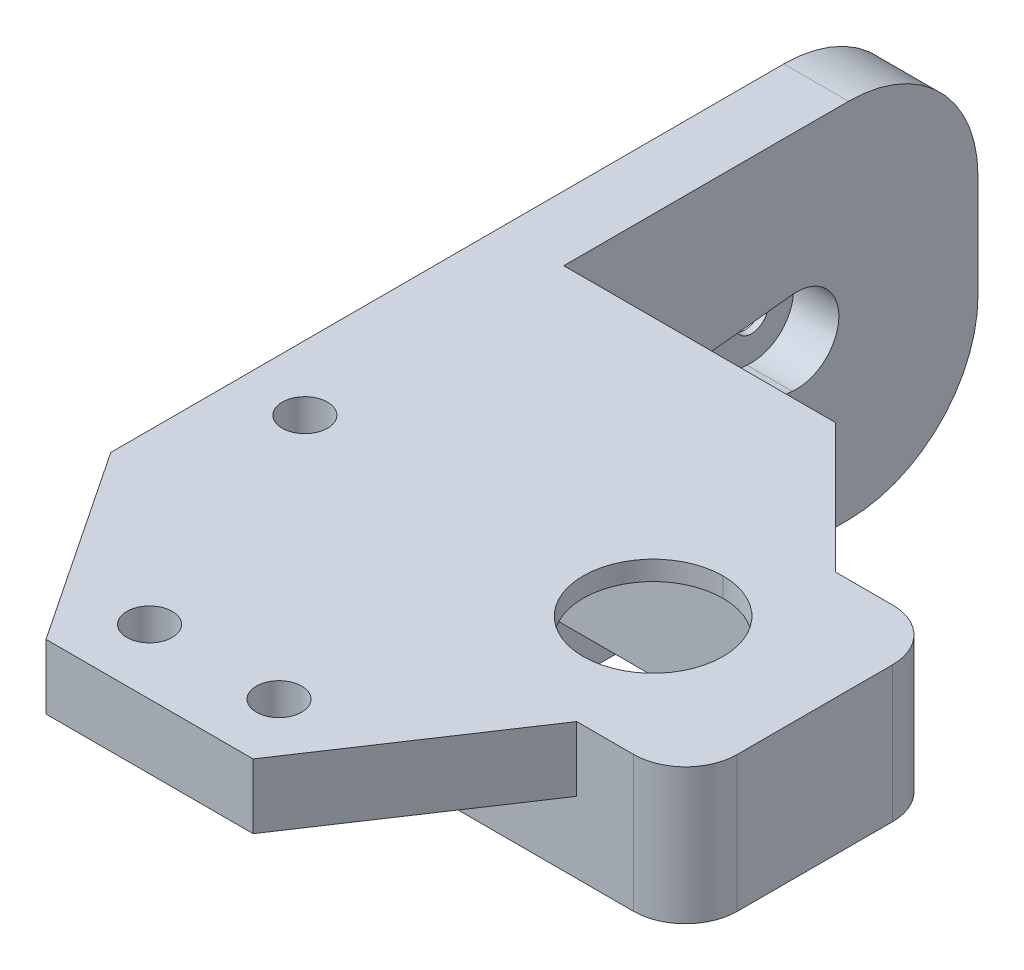
from build123d import *

# Parameters (mm, degrees)
SKETCH1_R                = 1.75
SKETCH1_W                = 7.2
SKETCH1_H                = 5.4
BOSS_EXTRUDE1_DEPTH      = 5
FILLET5_RADIUS           = 10
FILLET5_LENGTH           = 5
FILLET2_R                = 5.4
FILLET6_R                = 5.4
SKETCH3_W                = 6
SKETCH3_H                = 13
BOSS_EXTRUDE4_DEPTH      = 5.5
SKETCH5_W                = 23
SKETCH5_H                = 13
CUT_EXTRUDE1_DEPTH       = 3.5
CUT_EXTRUDE2_DEPTH       = 76.201396264
FILLET9_R                = 4
BOSS_EXTRUDE7_DEPTH      = 32
BOSS_EXTRUDE7_DEPTH_BACK = 12
SKETCH7_W                = 10
SKETCH7_H                = 28
FILLET10_R               = 10
SKETCH9_R                = 1
CUT_EXTRUDE4_DEPTH       = 7
SKETCH15_W               = 5
SKETCH15_H               = 32
CUT_EXTRUDE7_DEPTH       = 30
CUT_EXTRUDE8_DEPTH       = 5
CUT_EXTRUDE9_DEPTH       = 3.5
SKETCH22_R               = 1.3
CUT_EXTRUDE10_DEPTH      = 1.5
SKETCH22_3_R             = 2.35
SKETCH22_3_R_2           = 1.3
CUT_EXTRUDE11_DEPTH      = 1
SKETCH23_R               = 0.75
CUT_EXTRUDE12_DEPTH      = 1.75


with BuildPart() as part:
    # Sketch1 → Boss-Extrude1 (new body)
    # profile 1 of 4: a face of its own
    with BuildSketch(Plane(origin=(0, 0, 0), x_dir=(1, 0, 0), z_dir=(0, 1, 0))):
        with BuildLine():
            Line((3.25, 25), (0, 25))
            Line((0, 25), (0, 15))
            Line((0, 15), (10, 0))
            Line((10, 0), (26, 0))
            Line((26, 0), (36, 15))
            Line((36, 15), (60, 15))
            Line((60, 15), (60, 25))
            Line((60, 25), (44.5, 25))
            Line((44.5, 25), (44.5, 19.6))
            Line((44.5, 19.6), (37.3, 19.6))
            Line((37.3, 19.6), (26.5, 19.6))
            Line((26.5, 19.6), (26.5, 25))
            Line((26.5, 25), (6.75, 25))
            ThreePointArc((6.75, 25), (5, 23.25), (3.25, 25))
        make_face()
        with Locations(Location((13, 5, 0), (0, 0, 270))):
            Circle(SKETCH1_R, mode=Mode.SUBTRACT)
        with Locations(Location((23, 5, 0), (0, 0, 270))):
            Circle(SKETCH1_R, mode=Mode.SUBTRACT)
    # profile 2 of 4: a face of its own
    with BuildSketch(Plane(origin=(0, 0, 0), x_dir=(1, 0, 0), z_dir=(0, 1, 0))):
        with BuildLine():
            Line((10, 45), (0, 33.819660113))
            Line((0, 33.819660113), (0, 25))
            Line((0, 25), (3.25, 25))
            ThreePointArc((3.25, 25), (5, 26.75), (6.75, 25))
            Line((6.75, 25), (26.5, 25))
            Line((26.5, 25), (26.5, 30.4))
            Line((26.5, 30.4), (37.3, 30.4))
            Line((37.3, 30.4), (44.5, 30.4))
            Line((44.5, 30.4), (44.5, 25))
            Line((44.5, 25), (60, 25))
            Line((60, 25), (60, 35))
            Line((60, 35), (36, 35))
            Line((36, 35), (26, 45))
            Line((26, 45), (10, 45))
        make_face()
    # profile 3 of 4: a face of its own
    with BuildSketch(Plane(origin=(0, 0, 0), x_dir=(1, 0, 0), z_dir=(0, 1, 0))):
        with Locations((40.9, 27.7)):
            Rectangle(SKETCH1_W, SKETCH1_H)
    # profile 4 of 4: a face of its own
    with BuildSketch(Plane(origin=(0, 0, 0), x_dir=(1, 0, 0), z_dir=(0, 1, 0))):
        with Locations((40.9, 22.3)):
            Rectangle(SKETCH1_W, SKETCH1_H)
    extrude(amount=BOSS_EXTRUDE1_DEPTH)

    # Fillet5: full round fillet: the end face becomes a half cylinder, R = half its width
    fillet5_face = Plane((60, 2.5, -25), x_dir=(0, -1, 0), z_dir=(1, 0, 0))  # on the end face: x along it, z out of the body
    fillet5_slab = fillet5_face.offset(-FILLET5_RADIUS / 2) * Box(FILLET5_LENGTH, 2 * FILLET5_RADIUS, FILLET5_RADIUS, mode=Mode.PRIVATE)  # the body's end, R deep
    fillet5_round = Plane((50, 2.5, -25), x_dir=(1, 0, 0), z_dir=(0, -1, 0)) * Cylinder(FILLET5_RADIUS, FILLET5_LENGTH, mode=Mode.PRIVATE)  # its axis R under the face
    add(fillet5_slab - fillet5_round, mode=Mode.SUBTRACT)

    # Fillet2
    fillet2_edges = [part.edges().sort_by_distance(p)[0] for p in [
        (26.5, 2.5, -30.4),
        (26.5, 2.5, -19.6),
    ]]
    fillet(fillet2_edges, radius=FILLET2_R - 0.0001)  # a hair under: the kernel refuses the full size

    # Fillet6
    fillet6_edges = [part.edges().sort_by_distance(p)[0] for p in [
        (37.3, 2.5, -19.6),
        (37.3, 2.5, -30.4),
    ]]
    fillet(fillet6_edges, radius=FILLET6_R - 0.0001)  # a hair under: the kernel refuses the full size

    # Sketch3 → Boss-Extrude4 (add)
    with BuildSketch(Plane.XZ):
        with Locations((12.4, -25)):
            Rectangle(SKETCH3_W, SKETCH3_H)
        Polygon((38.4, -25), (38.4, -31.5), (44.4, -31.5), (44.4, -18.5), (38.4, -18.5), align=None)
        Polygon((31.9, -31.5), (15.4, -31.5), (9.4, -31.5), (9.4, -35), (36, -35), (44.4, -35), (44.4, -31.5), (38.4, -31.5), align=None)
        Polygon((9.4, -18.5), (15.4, -18.5), (31.9, -18.5), (38.4, -18.5), (44.4, -18.5), (44.4, -15), (36, -15), (9.4, -15), align=None)
    extrude(amount=BOSS_EXTRUDE4_DEPTH)

    # Sketch5 → Cut-Extrude1 (cut)
    with BuildSketch(Plane.XZ):
        with Locations((26.9, -25)):
            Rectangle(SKETCH5_W, SKETCH5_H)
    extrude(amount=-CUT_EXTRUDE1_DEPTH, mode=Mode.SUBTRACT)

    # Sketch6 → Cut-Extrude2 (cut, through all)
    with BuildSketch(Plane.XZ):
        with BuildLine():
            Line((44.4, -15), (44.4, -35))
            Line((44.4, -35), (50, -35))
            ThreePointArc((50, -35), (60, -25), (50, -15))
            Line((50, -15), (44.4, -15))
        make_face()
    extrude(amount=-CUT_EXTRUDE2_DEPTH, mode=Mode.SUBTRACT)

    # Fillet9
    fillet9_edges = [part.edges().sort_by_distance(p)[0] for p in [
        (44.4, -0.25, -35),
        (44.4, -0.25, -15),
    ]]
    fillet(fillet9_edges, radius=FILLET9_R)

    # Sketch7 → Boss-Extrude7 (add, two sides: drawn at the far end of the back side and taken through both)
    with BuildSketch(Plane(origin=(0, 0, -45), x_dir=(-1, 0, 0), z_dir=(0, 0, -1)).offset(-BOSS_EXTRUDE7_DEPTH_BACK)):
        with Locations((-5, -9)):
            Rectangle(SKETCH7_W, SKETCH7_H)
    extrude(amount=BOSS_EXTRUDE7_DEPTH + BOSS_EXTRUDE7_DEPTH_BACK)

    # Fillet10
    fillet10_edges = [part.edges().sort_by_distance(p)[0] for p in [
        (5, 5, -77),
        (5, -23, -33),
        (5, -23, -77),
    ]]
    fillet(fillet10_edges, radius=FILLET10_R)

    # Sketch9 → Cut-Extrude4 (cut)
    with BuildSketch(Plane.XZ.offset(5.5)):
        with Locations(Location((13.1, -25, 0), (0, 0, 270))):
            Circle(SKETCH9_R)
        with Locations(Location((40.7, -25, 0), (0, 0, 270))):
            Circle(SKETCH9_R)
    extrude(amount=-CUT_EXTRUDE4_DEPTH, mode=Mode.SUBTRACT)

    # Sketch15 → Cut-Extrude7 (cut)
    with BuildSketch(Plane(origin=(0, 5, 0), x_dir=(1, 0, 0), z_dir=(0, 1, 0))):
        with Locations((7.5, 61)):
            Rectangle(SKETCH15_W, SKETCH15_H)
    extrude(amount=-CUT_EXTRUDE7_DEPTH, mode=Mode.SUBTRACT)

    # Sketch17 → Cut-Extrude8 (cut)
    with BuildSketch(Plane(origin=(10, 0, 0), x_dir=(0, 0, -1), z_dir=(1, 0, 0))):
        with BuildLine():
            Line((45, -23), (45, 0))
            Line((45, 0), (35, 0))
            Line((35, 0), (35, -5.5))
            Line((35, -5.5), (33, -5.5))
            Line((33, -5.5), (33, -13))
            ThreePointArc((33, -13), (35.928932188, -20.071067812), (43, -23))
            Line((43, -23), (45, -23))
        make_face()
    extrude(amount=-CUT_EXTRUDE8_DEPTH, mode=Mode.SUBTRACT)

    # Sketch8 → Cut-Extrude9 (cut)
    with BuildSketch(Plane(origin=(5, 0, 0), x_dir=(0, 0, -1), z_dir=(1, 0, 0))):
        with BuildLine():
            Line((62.651785714, -5.768708182), (48.8125, -7.260073637))
            ThreePointArc((48.8125, -7.260073637), (47.25, -9), (48.8125, -10.739926363))
            Line((48.8125, -10.739926363), (62.651785714, -12.231291818))
            ThreePointArc((62.651785714, -12.231291818), (66.25, -9), (62.651785714, -5.768708182))
        make_face()
    extrude(amount=-CUT_EXTRUDE9_DEPTH, mode=Mode.SUBTRACT)

    # Sketch22 → Cut-Extrude10 (cut)
    with BuildSketch(Plane.ZY):
        with Locations((-63, -9)):
            Circle(SKETCH22_R)
    extrude(amount=-CUT_EXTRUDE10_DEPTH, mode=Mode.SUBTRACT)

    # Sketch22<3> → Cut-Extrude11 (cut)
    with BuildSketch(Plane.ZY):
        with Locations((-63, -9)):
            Circle(SKETCH22_3_R)
        with Locations((-63, -9)):
            Circle(SKETCH22_3_R_2, mode=Mode.SUBTRACT)
    extrude(amount=-CUT_EXTRUDE11_DEPTH, mode=Mode.SUBTRACT)

    # Sketch23 → Cut-Extrude12 (cut)
    with BuildSketch(Plane.ZY):
        with Locations((-49, -9)):
            Circle(SKETCH23_R)
    extrude(amount=-CUT_EXTRUDE12_DEPTH, mode=Mode.SUBTRACT)


solid = part.part
